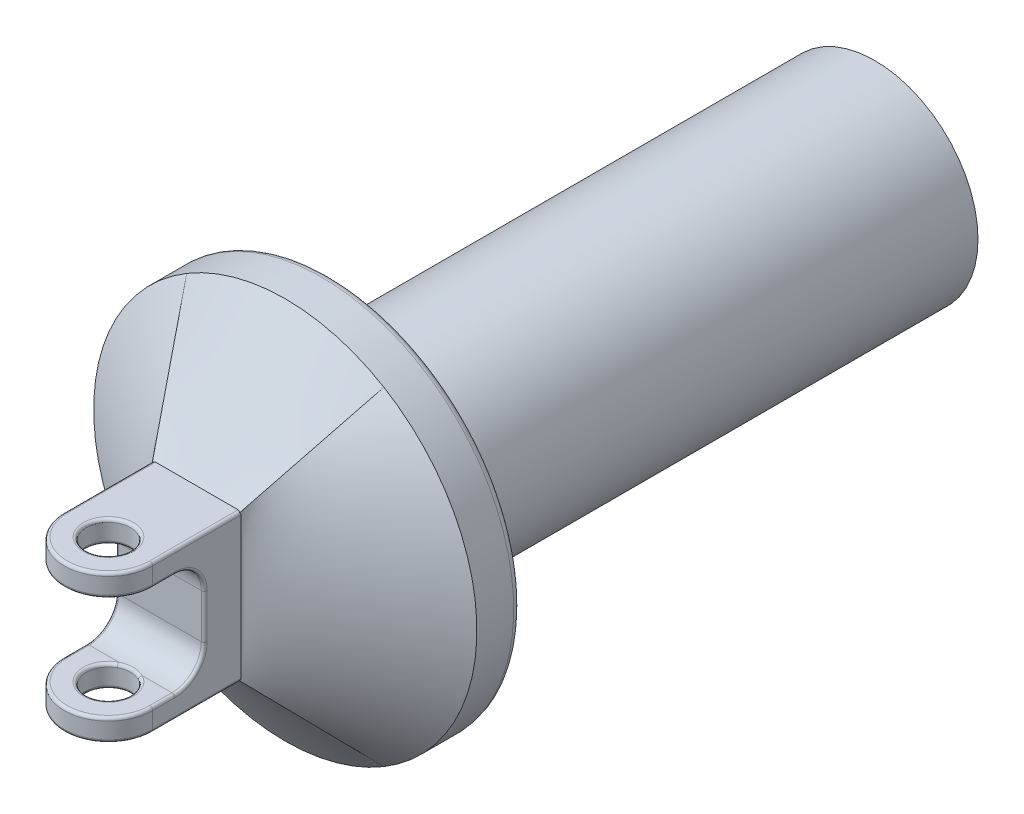
from build123d import *

# Parameters (mm, degrees)
SKETCH1_R                 = 15
BOSS_EXTRUDE1_DEPTH       = 100
BOSS_EXTRUDE2_OUTLINE_R   = 130
BOSS_EXTRUDE2_OUTLINE_R_2 = 105
BOSS_EXTRUDE2_DEPTH       = 30
SKETCH9_R                 = 70
SKETCH9_R_2               = 40
BOSS_EXTRUDE3_DEPTH       = 400
CUT_EXTRUDE1_DEPTH        = 566.420197784
CUT_EXTRUDE1_DEPTH_BACK   = 566.420197784
SKETCH10_W                = 130
SKETCH10_H                = 70
FILLET1_R                 = 20
FILLET2_R                 = 2
FILLET3_R                 = 5


with BuildPart() as part:
    # Sketch1 → Boss-Extrude1 (new body)
    with BuildSketch(Plane(origin=(0, 0, 0), x_dir=(1, 0, 0), z_dir=(0, 1, 0))):
        with BuildLine():
            Line((-30, 0), (-30, 60))
            Line((-30, 60), (30, 60))
            Line((30, 60), (30, 0))
            ThreePointArc((30, 0), (0, -30), (-30, 0))
        make_face()
        with Locations(Location((0, 0, 0), (0, 0, 270))):
            Circle(SKETCH1_R, mode=Mode.SUBTRACT)
    extrude(amount=BOSS_EXTRUDE1_DEPTH)

    # Sketch2 → Loft2 section 0
    with BuildSketch(Plane(origin=(0, 0, -60), x_dir=(-1, 0, 0), z_dir=(0, 0, -1))):
        with BuildLine():
            Line((-30, 0), (30, 0))
            Line((30, 0), (30, 100))
            Line((30, 100), (-30, 100))
            Line((-30, 100), (-30, 0))
        make_face()
    # Sketch3 for Loft2 → Loft2 section 1
    with BuildSketch(Plane.XY.offset(-120)):
        with BuildLine():
            # circular arc as an exact rational Bezier (weights 1, cos(half-angle), 1)
            Bezier((66.884448206, -61.474080343), (0, -101.604749265), (-66.884448206, -61.474080343), weights=[1, 0.857492926, 1])
            Bezier((-66.884448206, -61.474080343), (-252.674582107, 50), (-66.884448206, 161.474080343), weights=[1, 0.514495755, 1])
            Bezier((-66.884448206, 161.474080343), (0, 201.604749265), (66.884448206, 161.474080343), weights=[1, 0.857492926, 1])
            Bezier((66.884448206, 161.474080343), (252.674582107, 50), (66.884448206, -61.474080343), weights=[1, 0.514495755, 1])
        make_face()
    loft()

    # Boss-Extrude2: read off the stored shape, not the designer's step
    # Boss-Extrude2 outline → Boss-Extrude2 (add)
    with BuildSketch(Plane(origin=(0, 0, -120), x_dir=(-1, 0, 0), z_dir=(0, 0, -1))):
        with Locations((0, 50)):
            Circle(BOSS_EXTRUDE2_OUTLINE_R)
        with Locations((0, 50)):
            Circle(BOSS_EXTRUDE2_OUTLINE_R_2, mode=Mode.SUBTRACT)
    extrude(amount=BOSS_EXTRUDE2_DEPTH)

    # Sketch9 → Boss-Extrude3 (add)
    with BuildSketch(Plane(origin=(0, 0, -120), x_dir=(-1, 0, 0), z_dir=(0, 0, -1))):
        with Locations(Location((0, 50, 0), (0, 0, 180))):
            Circle(SKETCH9_R)
        with Locations(Location((0, 50, 0), (0, 0, 180))):
            Circle(SKETCH9_R_2, mode=Mode.SUBTRACT)
    extrude(amount=BOSS_EXTRUDE3_DEPTH)

    # Sketch10 → Cut-Extrude1 (cut, two sides: drawn at the far end of the back side and taken through both)
    with BuildSketch(Plane(origin=(0, 0, 0), x_dir=(0, 0, -1), z_dir=(1, 0, 0)).offset(-CUT_EXTRUDE1_DEPTH_BACK)):
        with Locations((-30, 50)):
            Rectangle(SKETCH10_W, SKETCH10_H)
    extrude(amount=CUT_EXTRUDE1_DEPTH + CUT_EXTRUDE1_DEPTH_BACK, mode=Mode.SUBTRACT)

    # Fillet1
    fillet1_edges = [part.edges().sort_by_distance(p)[0] for p in [
        (0, 85, -35),
        (0, 15, -35),
    ]]
    fillet(fillet1_edges, radius=FILLET1_R - 0.0001)  # a hair under: the kernel refuses the full size

    # Fillet2
    fillet2_edges = [part.edges().sort_by_distance(p)[0] for p in [
        (0, 0, -15),
        (0, 100, -15),
        (-30, 100, -30),
        (0, 100, 30),
        (-30, 0, -30),
        (30, 0, -30),
        (0, 0, 30),
        (0, 15, 30),
        (-30, 15, -7.50005),
        (0, 15, -15),
        (0, 85, 30),
        (30, 85, -7.50005),
        (0, 85, -15),
        (30, 100, -30),
        (-30, 50, -35),
        (30, 50, -35),
        (30, 15, -7.50005),
        (-30, 85, -7.50005),
        (30, 20.857835087, -29.142164913),
        (-30, 20.857835087, -29.142164913),
        (30, 79.142164913, -29.142164913),
        (-30, 79.142164913, -29.142164913),
    ]]
    fillet(fillet2_edges, radius=FILLET2_R)

    # Fillet3
    fillet3_edges = [part.edges().sort_by_distance(p)[0] for p in [
        (130, 50, -150),
        (105, 50, -150),
        (105, 50, -120),
        (-70, 50, -120),
    ]]
    fillet(fillet3_edges, radius=FILLET3_R)


solid = part.part
